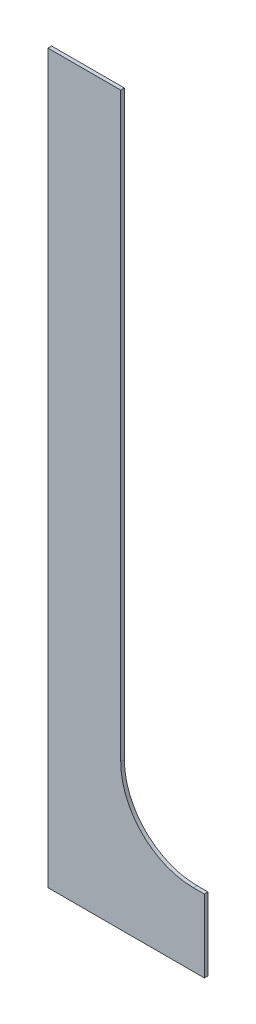
from build123d import *

# Parameters (mm, degrees)
EXTRUDE_1_DEPTH = 0.5
FILLET_1_R      = 10


with BuildPart() as part:
    # 草图1 → 凸台-拉伸1 (new body)
    with BuildSketch(Plane.XY):
        Polygon((0, 0), (-21.5, 0), (-21.5, 100), (-11.5, 100), (-11.5, 10), (0, 10), align=None)
    extrude(amount=EXTRUDE_1_DEPTH)

    # 圆角1
    fillet_1_edges = [part.edges().sort_by_distance(p)[0] for p in [
        (-11.5, 10, 0.25),
    ]]
    fillet(fillet_1_edges, radius=FILLET_1_R)


solid = part.part
